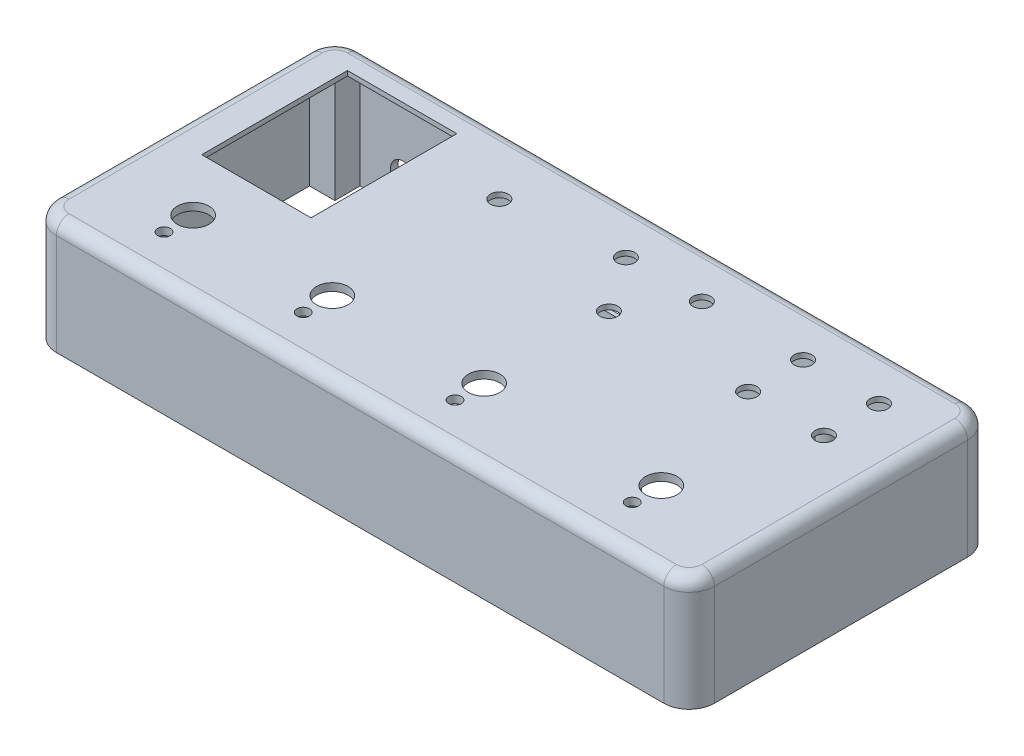
from build123d import *

# Parameters (mm, degrees)
SKETCH_1_W                = 260
SKETCH_1_H                = 120
SKETCH_1_R                = 3.5
SKETCH_1_R_2              = 6.25
SKETCH_1_R_3              = 2.5
SKETCH_1_W_2              = 43.2
SKETCH_1_H_2              = 57.6
EXTRUDE_1_DEPTH           = 45
SKETCH_3_W                = 254
SKETCH_3_H                = 114
CUT_EXTRUDE_2_DEPTH       = 42
FILLET_3_R                = 10
FILLET_5_R                = 5
SKETCH_4_W                = 48
SKETCH_4_H                = 67
CUT_EXTRUDE_3_DEPTH       = 2
SKETCH_6_W                = 48
SKETCH_6_H                = 5.57
SKETCH_6_H_2              = 6.43
EXTRUDE_2_DEPTH           = 1
SKETCH_7_R                = 1.75
CUT_EXTRUDE_4_DEPTH       = 3
SKETCH_8_W                = 48
SKETCH_8_H                = 67
SKETCH_8_W_2              = 43.2
SKETCH_8_H_2              = 57.6
EXTRUDE_3_DEPTH           = 0.87
SKETCH_9_W                = 35.116619727
SKETCH_9_H                = 5.57
CUT_EXTRUDE_5_DEPTH       = 2.13
SKETCH_10_W               = 10
SKETCH_10_H               = 14
CUT_EXTRUDE_6_DEPTH       = 1
SKETCH_11_R               = 4
SKETCH_11_R_2             = 1.75000254
EXTRUDE_4_DEPTH           = 36
FILLET_6_R                = 2
SKETCH_12_R               = 5
CUT_EXTRUDE_7_DEPTH       = 6
EXTRUDE_5_DEPTH           = 42
EXTRUDE_7_DEPTH           = 42
EXTRUDE_8_DEPTH           = 42
SKETCH_18_R               = 3.25
CUT_EXTRUDE_8_DEPTH       = 42
CUT_EXTRUDE_9_DEPTH       = 10
CUT_EXTRUDE_START         = -3
CUT_EXTRUDE_1_OUTLINE_R   = 3
CUT_EXTRUDE_1_OUTLINE_R_2 = 2.5
CUT_EXTRUDE_1_OUTLINE_W   = 9.999999815
CUT_EXTRUDE_1_OUTLINE_H   = 11.999999774
CUT_EXTRUDE_1_OUTLINE_W_2 = 8.999999815
CUT_EXTRUDE_1_OUTLINE_H_2 = 10.999999774
CUT_EXTRUDE_1_DEPTH       = 3
SKETCH_21_W               = 32.829276635
SKETCH_21_H               = 12.018710366
CUT_EXTRUDE_10_DEPTH      = 1.5
FILLET_7_R                = 1


# Read off the part's stored shape, not the designer's step: 切除-拉伸-薄壁1
with BuildPart() as part:
    # 草图1 → 凸台-拉伸1 (new body)
    with BuildSketch(Plane(origin=(0, 0, 0), x_dir=(1, 0, 0), z_dir=(0, 1, 0))):
        with Locations((-0.969995419, -25.404739255)):
            Rectangle(SKETCH_1_W, SKETCH_1_H)
        with Locations(Location((-40.969995419, 9.595260745, 0), (0, 0, 90))):
            Circle(SKETCH_1_R, mode=Mode.SUBTRACT)
        with Locations(Location((4.030004581, 14.595260745, 0), (0, 0, 90))):
            Circle(SKETCH_1_R, mode=Mode.SUBTRACT)
        with Locations(Location((34.030004581, 14.595260745, 0), (0, 0, 90))):
            Circle(SKETCH_1_R, mode=Mode.SUBTRACT)
        with Locations(Location((19.030004581, -7.133936568, 0), (0, 0, 90))):
            Circle(SKETCH_1_R, mode=Mode.SUBTRACT)
        with Locations(Location((74.030004581, 14.595260745, 0), (0, 0, 90))):
            Circle(SKETCH_1_R, mode=Mode.SUBTRACT)
        with Locations(Location((104.030004581, 14.595260745, 0), (0, 0, 90))):
            Circle(SKETCH_1_R, mode=Mode.SUBTRACT)
        with Locations(Location((74.030004581, -7.133936568, 0), (0, 0, 90))):
            Circle(SKETCH_1_R, mode=Mode.SUBTRACT)
        with Locations(Location((104.030004581, -7.133936568, 0), (0, 0, 90))):
            Circle(SKETCH_1_R, mode=Mode.SUBTRACT)
        with Locations(Location((89.030004581, -56.404739255, 0), (0, 0, 90))):
            Circle(SKETCH_1_R_2, mode=Mode.SUBTRACT)
        with Locations(Location((19.030004581, -56.404739255, 0), (0, 0, 90))):
            Circle(SKETCH_1_R_2, mode=Mode.SUBTRACT)
        with Locations(Location((-40.969995419, -56.404739255, 0), (0, 0, 90))):
            Circle(SKETCH_1_R_2, mode=Mode.SUBTRACT)
        with Locations(Location((-95.969995419, -56.404739255, 0), (0, 0, 90))):
            Circle(SKETCH_1_R_2, mode=Mode.SUBTRACT)
        with Locations(Location((-95.969995419, -67.904739255, 0), (0, 0, 90))):
            Circle(SKETCH_1_R_3, mode=Mode.SUBTRACT)
        with Locations(Location((-40.969995419, -67.904739255, 0), (0, 0, 90))):
            Circle(SKETCH_1_R_3, mode=Mode.SUBTRACT)
        with Locations(Location((19.030004581, -67.904739255, 0), (0, 0, 90))):
            Circle(SKETCH_1_R_3, mode=Mode.SUBTRACT)
        with Locations(Location((89.030004581, -67.904739255, 0), (0, 0, 90))):
            Circle(SKETCH_1_R_3, mode=Mode.SUBTRACT)
        with Locations((-93.369995419, -5.204739255)):
            Rectangle(SKETCH_1_W_2, SKETCH_1_H_2, mode=Mode.SUBTRACT)
    extrude(amount=EXTRUDE_1_DEPTH)

    # 草图3 → 切除-拉伸2 (cut)
    with BuildSketch(Plane.XZ):
        with Locations((-0.969995419, 25.404739255)):
            Rectangle(SKETCH_3_W, SKETCH_3_H)
    extrude(amount=-CUT_EXTRUDE_2_DEPTH, mode=Mode.SUBTRACT)

    # 圆角3
    fillet_3_edges = [part.edges().sort_by_distance(p)[0] for p in [
        (-127.969995419, 21, 82.404739255),
        (-127.969995419, 21, -31.595260745),
        (126.030004581, 21, -31.595260745),
        (126.030004581, 21, 82.404739255),
        (-130.969995419, 22.5, -34.595260745),
        (129.030004581, 22.5, -34.595260745),
        (129.030004581, 22.5, 85.404739255),
        (-130.969995419, 22.5, 85.404739255),
    ]]
    fillet(fillet_3_edges, radius=FILLET_3_R)

    # 圆角5
    fillet_5_edges = [part.edges().sort_by_distance(p)[0] for p in [
        (-130.969995419, 45, 25.404739255),
        (-0.969995419, 45, -34.595260745),
        (-0.969995419, 45, 85.404739255),
        (129.030004581, 45, 25.404739255),
        (126.101072393, 45, -31.666328557),
        (126.101072393, 45, 82.475807066),
        (-128.041063231, 45, 82.475807066),
        (-128.041063231, 45, -31.666328557),
    ]]
    fillet(fillet_5_edges, radius=FILLET_5_R)

    # 草图4 → 切除-拉伸3 (cut)
    with BuildSketch(Plane.XZ.offset(-42)):
        with Locations((-93.369995419, 7.474739255)):
            Rectangle(SKETCH_4_W, SKETCH_4_H)
    extrude(amount=-CUT_EXTRUDE_3_DEPTH, mode=Mode.SUBTRACT)

    # 草图6 → 凸台-拉伸2 (add)
    with BuildSketch(Plane.XZ.offset(-42)):
        with Locations((-93.369995419, -28.810260745)):
            Rectangle(SKETCH_6_W, SKETCH_6_H)
        with Locations((-93.369995419, 44.189739255)):
            Rectangle(SKETCH_6_W, SKETCH_6_H_2)
    extrude(amount=EXTRUDE_2_DEPTH)

    # 草图7 → 切除-拉伸4 (cut)
    with BuildSketch(Plane.XZ.offset(-41)):
        with Locations(Location((-72.369995419, -28.595260745, 0), (0, 0, 270))):
            Circle(SKETCH_7_R)
        with Locations(Location((-114.369995419, -28.595260745, 0), (0, 0, 270))):
            Circle(SKETCH_7_R)
        with Locations(Location((-114.369995419, 44.404739255, 0), (0, 0, 270))):
            Circle(SKETCH_7_R)
        with Locations(Location((-72.369995419, 44.404739255, 0), (0, 0, 270))):
            Circle(SKETCH_7_R)
    extrude(amount=-CUT_EXTRUDE_4_DEPTH, mode=Mode.SUBTRACT)

    # 草图8 → 凸台-拉伸3 (add)
    with BuildSketch(Plane.XZ.offset(-44)):
        with Locations((-93.369995419, 7.474739255)):
            Rectangle(SKETCH_8_W, SKETCH_8_H)
        with Locations((-93.369995419, 5.204739255)):
            Rectangle(SKETCH_8_W_2, SKETCH_8_H_2, mode=Mode.SUBTRACT)
    extrude(amount=EXTRUDE_3_DEPTH)

    # 草图9 → 切除-拉伸5 (cut)
    with BuildSketch(Plane.XZ.offset(-41)):
        with Locations((-94.366088611, -28.810260745)):
            Rectangle(SKETCH_9_W, SKETCH_9_H)
    extrude(amount=-CUT_EXTRUDE_5_DEPTH, mode=Mode.SUBTRACT)

    # 草图10 → 切除-拉伸6 (cut)
    with BuildSketch(Plane.XZ.offset(-42)):
        with Locations((104.030004581, -14.595260745)):
            Rectangle(SKETCH_10_W, SKETCH_10_H)
        with Locations((104.030004581, 7.133936568)):
            Rectangle(SKETCH_10_W, SKETCH_10_H)
        with Locations((74.030004581, -14.595260745)):
            Rectangle(SKETCH_10_W, SKETCH_10_H)
        with Locations((74.030004581, 7.133936568)):
            Rectangle(SKETCH_10_W, SKETCH_10_H)
        with Locations((34.030004581, -14.595260745)):
            Rectangle(SKETCH_10_W, SKETCH_10_H)
        with Locations((19.030004581, 7.133936568)):
            Rectangle(SKETCH_10_W, SKETCH_10_H)
        with Locations((4.030004581, -14.595260745)):
            Rectangle(SKETCH_10_W, SKETCH_10_H)
        with Locations((-40.969995419, -9.595260745)):
            Rectangle(SKETCH_10_W, SKETCH_10_H)
    extrude(amount=-CUT_EXTRUDE_6_DEPTH, mode=Mode.SUBTRACT)

    # 草图11 → 凸台-拉伸4 (add)
    # profile 1 of 10: a face of its own
    with BuildSketch(Plane.XZ.offset(-42)):
        with Locations(Location((70.977965277, 51.835651116, 0), (0, 0, 90))):
            Circle(SKETCH_11_R)
        with Locations(Location((70.977965277, 51.835651116, 0), (0, 0, 90))):
            Circle(SKETCH_11_R_2, mode=Mode.SUBTRACT)
    # profile 2 of 10: a face of its own
    with BuildSketch(Plane.XZ.offset(-42)):
        with Locations((70.850965023, -28.04750865)):
            Circle(SKETCH_11_R)
        with Locations(Location((70.850965023, -28.04750865, 0), (0, 0, 90))):
            Circle(SKETCH_11_R_2, mode=Mode.SUBTRACT)
    # profile 3 of 10: a face of its own
    with BuildSketch(Plane.XZ.offset(-42)):
        with Locations(Location((-61.229299137, -13.950480456, 0), (0, 0, 90))):
            Circle(SKETCH_11_R)
        with Locations(Location((-61.229299137, -13.950480456, 0), (0, 0, 90))):
            Circle(SKETCH_11_R_2, mode=Mode.SUBTRACT)
    # profile 4 of 10: a face of its own
    with BuildSketch(Plane.XZ.offset(-42)):
        with Locations(Location((-61.737300153, 51.708650862, 0), (0, 0, 90))):
            Circle(SKETCH_11_R)
        with Locations(Location((-61.737300153, 51.708650862, 0), (0, 0, 90))):
            Circle(SKETCH_11_R_2, mode=Mode.SUBTRACT)
    # profile 5 of 10: a face of its own
    with BuildSketch(Plane.XZ.offset(-42)):
        with BuildLine():
            Line((-65.283147245, 49.85744358), (-65.283147245, 53.559858145))
            ThreePointArc((-65.283147245, 53.559858145), (-65.737300153, 51.708650862), (-65.283147245, 49.85744358))
        make_face()
    # profile 6 of 10: a face of its own
    with BuildSketch(Plane.XZ.offset(-42)):
        with BuildLine():
            ThreePointArc((-59.464912407, 55.000497446), (-61.737300153, 55.708650862), (-64.0096879, 55.000497446))
            Line((-64.0096879, 55.000497446), (-59.464912407, 55.000497446))
        make_face()
    # profile 7 of 10: a face of its own
    with BuildSketch(Plane.XZ.offset(-42)):
        with BuildLine():
            ThreePointArc((73.424135286, 55.000497446), (70.977965277, 55.835651116), (68.531795269, 55.000497446))
            Line((68.531795269, 55.000497446), (73.424135286, 55.000497446))
        make_face()
    # profile 8 of 10: a face of its own
    with BuildSketch(Plane.XZ.offset(-42)):
        with BuildLine():
            Line((74.241871805, 54.147990663), (74.241871805, 49.52331157))
            ThreePointArc((74.241871805, 49.52331157), (74.789502114, 50.622314006), (74.977965277, 51.835651116))
            ThreePointArc((74.977965277, 51.835651116), (74.789502114, 53.048988227), (74.241871805, 54.147990663))
        make_face()
    # profile 9 of 10: a face of its own
    with BuildSketch(Plane.XZ.offset(-42)):
        with BuildLine():
            Line((73.441564792, -31.095260745), (68.260365254, -31.095260745))
            ThreePointArc((68.260365254, -31.095260745), (70.850965023, -32.04750865), (73.441564792, -31.095260745))
        make_face()
    # profile 10 of 10: a face of its own
    with BuildSketch(Plane.XZ.offset(-42)):
        with BuildLine():
            ThreePointArc((74.850965023, -28.04750865), (74.695677439, -26.943793815), (74.241871805, -25.925775585))
            Line((74.241871805, -25.925775585), (74.241871805, -30.169241714))
            ThreePointArc((74.241871805, -30.169241714), (74.695677439, -29.151223485), (74.850965023, -28.04750865))
        make_face()
    extrude(amount=EXTRUDE_4_DEPTH)

    # 圆角6
    # the kernel refuses this fillet: 2 mm, written as the material it adds along each edge
    with BuildSketch(Plane(origin=(-61.229299137, 42, -13.950480456), x_dir=(0, 0, 1), z_dir=(1, 0, 0))) as fillet_6_piece_1:
        with BuildLine():
            CenterArc((4 + FILLET_6_R, FILLET_6_R), FILLET_6_R, 180, 90)
            Line((4, FILLET_6_R), (4, 0))
            Line((4, 0), (4 + FILLET_6_R, 0))
        make_face()
    revolve(axis=Axis((-61.229299137, 42, -13.950480456), (0, -1, 0)))
    with BuildSketch(Plane(origin=(-61.737300153, 42, 51.708650862), x_dir=(0, 0, 1), z_dir=(1, 0, 0))) as fillet_6_piece_2:
        with BuildLine():
            CenterArc((4 + FILLET_6_R, FILLET_6_R), FILLET_6_R, 180, 90)
            Line((4, FILLET_6_R), (4, 0))
            Line((4, 0), (4 + FILLET_6_R, 0))
        make_face()
    revolve(axis=Axis((-61.737300153, 42, 51.708650862), (0, -1, 0)))
    with BuildSketch(Plane(origin=(70.977965277, 42, 51.835651116), x_dir=(0.8159766319524825, 0, 0.5780848865932089), z_dir=(0.5780848865932089, 0, -0.8159766319524825))) as fillet_6_piece_3:
        with BuildLine():
            CenterArc((4 + FILLET_6_R, FILLET_6_R), FILLET_6_R, 180, 90)
            Line((4, FILLET_6_R), (4, 0))
            Line((4, 0), (4 + FILLET_6_R, 0))
        make_face()
    revolve(axis=Axis((70.977965277, 42, 51.835651116), (0, -1, 0)), revolution_arc=54.684043806)
    with BuildSketch(Plane(origin=(70.850965023, 42, -28.04750865), x_dir=(-0.6476499423082869, 0, -0.7619380238760057), z_dir=(0.7619380238760057, 0, -0.6476499423082869))) as fillet_6_piece_4:
        with BuildLine():
            CenterArc((4 + FILLET_6_R, -FILLET_6_R), FILLET_6_R, 90, 90)
            Line((4, -FILLET_6_R), (4, 0))
            Line((4, 0), (4 + FILLET_6_R, 0))
        make_face()
    revolve(axis=Axis((70.850965023, 42, -28.04750865), (0, 1, 0)), revolution_arc=229.635348961)
    with BuildSketch(Plane(origin=(70.850965023, 42, -28.04750865), x_dir=(-0.6476499423082869, 0, -0.7619380238760057), z_dir=(-0.7619380238760057, 0, 0.6476499423082869))) as fillet_6_piece_5:
        with BuildLine():
            CenterArc((4 + FILLET_6_R, FILLET_6_R), FILLET_6_R, 180, 90)
            Line((4, FILLET_6_R), (4, 0))
            Line((4, 0), (4 + FILLET_6_R, 0))
        make_face()
    revolve(axis=Axis((70.850965023, 42, -28.04750865), (0, -1, 0)), revolution_arc=84.47592915)
    with BuildSketch(Plane(origin=(70.850965023, 42, -28.04750865), x_dir=(0.6476499423082945, 0, -0.7619380238759993), z_dir=(-0.7619380238759993, 0, -0.6476499423082945))) as fillet_6_piece_6:
        with BuildLine():
            CenterArc((4 + FILLET_6_R, FILLET_6_R), FILLET_6_R, 180, 90)
            Line((4, FILLET_6_R), (4, 0))
            Line((4, 0), (4 + FILLET_6_R, 0))
        make_face()
    revolve(axis=Axis((70.850965023, 42, -28.04750865), (0, -1, 0)), revolution_arc=49.635348961)
    with BuildSketch(Plane(origin=(70.850965023, 42, -28.04750865), x_dir=(-0.6960541392046369, 0, -0.7179893002657436), z_dir=(-0.7179893002657436, 0, 0.6960541392046369))) as fillet_6_piece_7:
        with BuildLine():
            CenterArc((4 + FILLET_6_R, FILLET_6_R), FILLET_6_R, 180, 90)
            Line((4, FILLET_6_R), (4, 0))
            Line((4, 0), (4 + FILLET_6_R, 0))
        make_face()
    revolve(axis=Axis((70.850965023, 42, -28.04750865), (0, -1, 0)), revolution_arc=84.47592915)
    with BuildSketch(Plane(origin=(70.977965277, 42, 51.835651116), x_dir=(0.8159766319524888, 0, -0.5780848865931999), z_dir=(-0.5780848865931999, 0, -0.8159766319524888))) as fillet_6_piece_8:
        with BuildLine():
            CenterArc((4 + FILLET_6_R, FILLET_6_R), FILLET_6_R, 180, 90)
            Line((4, FILLET_6_R), (4, 0))
            Line((4, 0), (4 + FILLET_6_R, 0))
        make_face()
    revolve(axis=Axis((70.977965277, 42, 51.835651116), (0, -1, 0)), revolution_arc=70.631912388)
    with BuildSketch(Plane(origin=(70.977965277, 42, 51.835651116), x_dir=(0, 0, 1), z_dir=(1, 0, 0))) as fillet_6_piece_9:
        with BuildLine():
            CenterArc((4 + FILLET_6_R, FILLET_6_R), FILLET_6_R, 180, 90)
            Line((4, FILLET_6_R), (4, 0))
            Line((4, 0), (4 + FILLET_6_R, 0))
        make_face()
    revolve(axis=Axis((70.977965277, 42, 51.835651116), (0, -1, 0)), revolution_arc=234.684043806)

    # 草图12 → 切除-拉伸7 (cut)
    with BuildSketch(Plane.XY.offset(-31.595260745)):
        with Locations((96.030004581, 12)):
            Circle(SKETCH_12_R)
        with Locations((-100.969995419, 12)):
            Circle(SKETCH_12_R)
    extrude(amount=-CUT_EXTRUDE_7_DEPTH, mode=Mode.SUBTRACT)

    # 草图14 → 凸台-拉伸5 (add)
    with BuildSketch(Plane.XZ.offset(-42)):
        with BuildLine():
            ThreePointArc((-127.969995419, 72.404739255), (-125.041063231, 79.475807066), (-117.969995419, 82.404739255))
            Line((-117.969995419, 82.404739255), (-117.969995419, 72.404739255))
            Line((-117.969995419, 72.404739255), (-127.969995419, 72.404739255))
        make_face()
    extrude(amount=EXTRUDE_5_DEPTH)

    # 草图16 → 凸台-拉伸7 (add)
    with BuildSketch(Plane.XZ.offset(-42)):
        with BuildLine():
            Line((116.030004581, -21.595260745), (116.030004581, -31.595260745))
            ThreePointArc((116.030004581, -31.595260745), (123.101072393, -28.666328557), (126.030004581, -21.595260745))
            Line((126.030004581, -21.595260745), (116.030004581, -21.595260745))
        make_face()
        with BuildLine():
            Line((126.030004581, 72.404739255), (116.030004581, 72.404739255))
            Line((116.030004581, 72.404739255), (116.030004581, 82.404739255))
            ThreePointArc((116.030004581, 82.404739255), (123.101072393, 79.475807066), (126.030004581, 72.404739255))
        make_face()
    extrude(amount=EXTRUDE_7_DEPTH)

    # 草图17 → 凸台-拉伸8 (add)
    with BuildSketch(Plane.XZ.offset(-42)):
        with BuildLine():
            Line((-117.969995419, -21.595260745), (-127.969995419, -21.595260745))
            ThreePointArc((-127.969995419, -21.595260745), (-125.041063231, -28.666328557), (-117.969995419, -31.595260745))
            Line((-117.969995419, -31.595260745), (-117.969995419, -21.595260745))
        make_face()
    extrude(amount=EXTRUDE_8_DEPTH)

    # 草图18 → 切除-拉伸8 (cut)
    with BuildSketch(Plane.XZ):
        with Locations(Location((-122.969995419, 77.404739255, 0), (0, 0, 270))):
            Circle(SKETCH_18_R)
        with Locations(Location((-122.969995419, -26.595260745, 0), (0, 0, 270))):
            Circle(SKETCH_18_R)
        with Locations(Location((121.030004581, -26.595260745, 0), (0, 0, 270))):
            Circle(SKETCH_18_R)
        with Locations(Location((121.030004581, 77.404739255, 0), (0, 0, 270))):
            Circle(SKETCH_18_R)
    extrude(amount=-CUT_EXTRUDE_8_DEPTH, mode=Mode.SUBTRACT)

    # 草图20 → 切除-拉伸9 (cut)
    with BuildSketch(Plane.XY.offset(-31.595260745)):
        with BuildLine():
            ThreePointArc((-7.508191695, 11.100000024), (-10.008191695, 8.600000024), (-7.508191695, 6.100000024))
            ThreePointArc((-7.508191695, 6.100000024), (-5.008191695, 8.600000024), (-7.508191695, 11.100000024))
        make_face()
        with BuildLine():
            Line((-15.442265785, 9.300000124), (-15.442265785, 8.501470108))
            ThreePointArc((-15.442265785, 8.501470108), (-15.487938067, 8.271860044), (-15.61800172, 8.07720603))
            Line((-15.61800172, 8.07720603), (-15.841896978, 7.853310773))
            ThreePointArc((-15.841896978, 7.853310773), (-15.928606081, 7.72354143), (-15.959054268, 7.570468054))
            Line((-15.959054268, 7.570468054), (-15.959054268, 6.800000073))
            ThreePointArc((-15.959054268, 6.800000073), (-16.134790203, 6.375735995), (-16.559054281, 6.20000006))
            Line((-16.559054281, 6.20000006), (-21.825477446, 6.20000006))
            ThreePointArc((-21.825477446, 6.20000006), (-22.249741523, 6.375735995), (-22.425477458, 6.800000073))
            Line((-22.425477458, 6.800000073), (-22.425477458, 7.570468054))
            ThreePointArc((-22.425477458, 7.570468054), (-22.455925646, 7.72354143), (-22.542634748, 7.853310773))
            Line((-22.542634748, 7.853310773), (-22.766530006, 8.07720603))
            ThreePointArc((-22.766530006, 8.07720603), (-22.89659366, 8.271860044), (-22.942265941, 8.501470108))
            Line((-22.942265941, 8.501470108), (-22.942265941, 9.300000124))
            ThreePointArc((-22.942265941, 9.300000124), (-22.766530006, 9.724264202), (-22.342265929, 9.900000137))
            Line((-22.342265929, 9.900000137), (-16.042265798, 9.900000137))
            ThreePointArc((-16.042265798, 9.900000137), (-15.61800172, 9.724264202), (-15.442265785, 9.300000124))
        make_face()
        Polygon((-61.92945145, 5.999999918), (-53.129451631, 5.999999918), (-53.029451633, 5.999999918), (-53.029451633, 6.099999916), (-53.029451633, 16.891372109), (-53.029451633, 16.899999694), (-53.029451633, 16.999999692), (-53.129451631, 16.999999692), (-61.92945145, 16.999999692), (-62.029451448, 16.999999692), (-62.029451448, 16.899999694), (-62.029451448, 9.753411886), (-62.029451448, 9.065749278), (-62.029451448, 6.099999916), (-62.029451448, 5.999999918), align=None)
    extrude(amount=-CUT_EXTRUDE_9_DEPTH, mode=Mode.SUBTRACT)

    # 切除-拉伸-薄壁1 outline → 切除-拉伸-薄壁1 (cut)
    # profile 1 of 3: a face of its own
    with BuildSketch(Plane.XY.offset(-31.595260745).offset(CUT_EXTRUDE_START)):
        with Locations((-7.508191695, 8.600000024)):
            Circle(CUT_EXTRUDE_1_OUTLINE_R)
        with Locations((-7.508191695, 8.600000024)):
            Circle(CUT_EXTRUDE_1_OUTLINE_R_2, mode=Mode.SUBTRACT)
    # profile 2 of 3: a face of its own
    with BuildSketch(Plane.XY.offset(-31.595260745).offset(CUT_EXTRUDE_START)):
        with BuildLine():
            Line((-14.942265785, 8.501470108), (-14.942265785, 9.300000124))
            ThreePointArc((-14.942265785, 9.300000124), (-15.26444833, 10.077817592), (-16.042265798, 10.400000137))
            Line((-16.042265798, 10.400000137), (-22.342265929, 10.400000137))
            ThreePointArc((-22.342265929, 10.400000137), (-23.120083397, 10.077817592), (-23.442265941, 9.300000124))
            Line((-23.442265941, 9.300000124), (-23.442265941, 8.501470108))
            ThreePointArc((-23.442265941, 8.501470108), (-23.358533426, 8.080518328), (-23.120083397, 7.72365264))
            Line((-23.120083397, 7.72365264), (-22.925477458, 7.529046701))
            Line((-22.925477458, 7.529046701), (-22.925477458, 6.800000073))
            ThreePointArc((-22.925477458, 6.800000073), (-22.603294914, 6.022182604), (-21.825477446, 5.70000006))
            Line((-21.825477446, 5.70000006), (-16.559054281, 5.70000006))
            ThreePointArc((-16.559054281, 5.70000006), (-15.781236812, 6.022182604), (-15.459054268, 6.800000073))
            Line((-15.459054268, 6.800000073), (-15.459054268, 7.529046701))
            Line((-15.459054268, 7.529046701), (-15.26444833, 7.72365264))
            ThreePointArc((-15.26444833, 7.72365264), (-15.025998301, 8.080518328), (-14.942265785, 8.501470108))
        make_face()
        with BuildLine():
            ThreePointArc((-16.042265798, 9.900000137), (-15.61800172, 9.724264202), (-15.442265785, 9.300000124))
            Line((-15.442265785, 9.300000124), (-15.442265785, 8.501470108))
            ThreePointArc((-15.442265785, 8.501470108), (-15.487938067, 8.271860044), (-15.61800172, 8.07720603))
            Line((-15.61800172, 8.07720603), (-15.841896978, 7.853310773))
            ThreePointArc((-15.841896978, 7.853310773), (-15.928606081, 7.723541431), (-15.959054268, 7.570468054))
            Line((-15.959054268, 7.570468054), (-15.959054268, 6.800000073))
            ThreePointArc((-15.959054268, 6.800000073), (-16.134790203, 6.375735995), (-16.559054281, 6.20000006))
            Line((-16.559054281, 6.20000006), (-21.825477446, 6.20000006))
            ThreePointArc((-21.825477446, 6.20000006), (-22.249741523, 6.375735995), (-22.425477458, 6.800000073))
            Line((-22.425477458, 6.800000073), (-22.425477458, 7.570468054))
            ThreePointArc((-22.425477458, 7.570468054), (-22.455925646, 7.72354143), (-22.542634748, 7.853310773))
            Line((-22.542634748, 7.853310773), (-22.766530006, 8.07720603))
            ThreePointArc((-22.766530006, 8.07720603), (-22.89659366, 8.271860043), (-22.942265941, 8.501470108))
            Line((-22.942265941, 8.501470108), (-22.942265941, 9.300000124))
            ThreePointArc((-22.942265941, 9.300000124), (-22.766530006, 9.724264202), (-22.342265929, 9.900000137))
            Line((-22.342265929, 9.900000137), (-16.042265798, 9.900000137))
        make_face(mode=Mode.SUBTRACT)
    # profile 3 of 3: a face of its own
    with BuildSketch(Plane.XY.offset(-31.595260745).offset(CUT_EXTRUDE_START)):
        with Locations((-57.529451541, 11.499999805)):
            Rectangle(CUT_EXTRUDE_1_OUTLINE_W, CUT_EXTRUDE_1_OUTLINE_H)
        with Locations((-57.529451541, 11.499999805)):
            Rectangle(CUT_EXTRUDE_1_OUTLINE_W_2, CUT_EXTRUDE_1_OUTLINE_H_2, mode=Mode.SUBTRACT)
    extrude(amount=CUT_EXTRUDE_1_DEPTH, mode=Mode.SUBTRACT)

    # 草图21 → 切除-拉伸10 (cut)
    with BuildSketch(Plane(origin=(0, 0, -34.595260745), x_dir=(-1, 0, 0), z_dir=(0, 0, -1))):
        with Locations((14.769012612, 8.80845864)):
            Rectangle(SKETCH_21_W, SKETCH_21_H)
    extrude(amount=-CUT_EXTRUDE_10_DEPTH, mode=Mode.SUBTRACT)

    # 圆角7
    fillet_7_edges = [part.edges().sort_by_distance(p)[0] for p in [
        (-14.769012612, 14.817813823, -33.095260745),
        (-14.769012612, 2.799103457, -33.095260745),
    ]]
    fillet(fillet_7_edges, radius=FILLET_7_R)


solid = part.part
